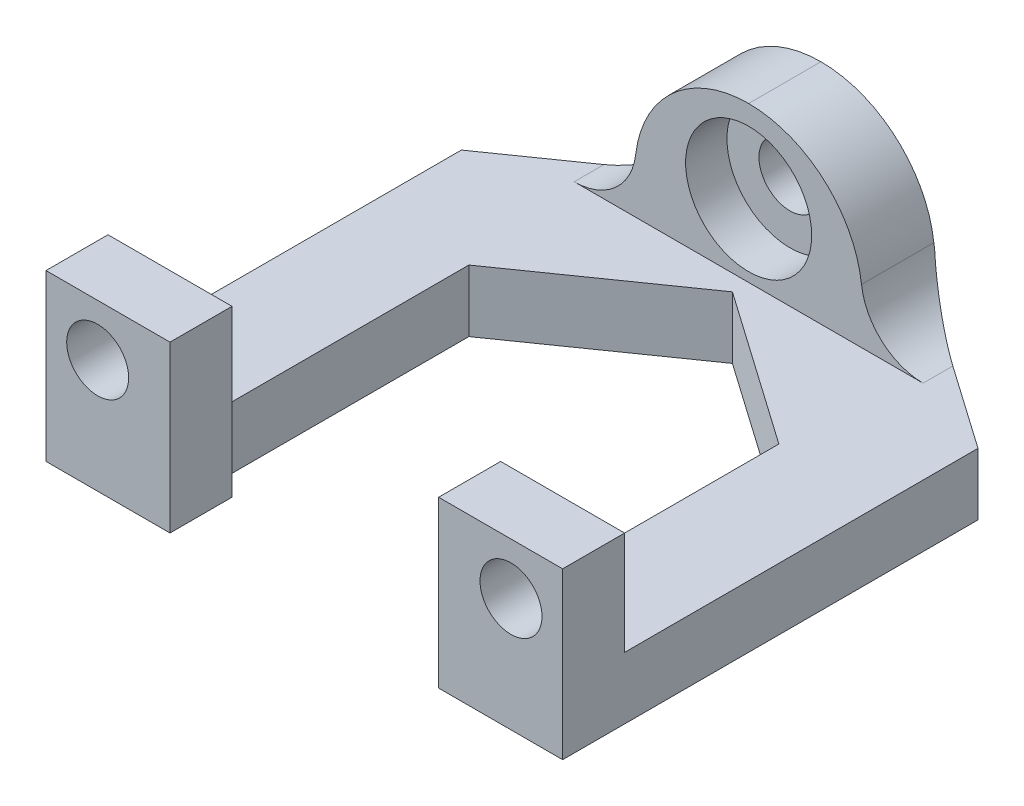
from build123d import *

# Parameters (mm, degrees)
BOSS_EXTRUDE1_DEPTH = 3
SKETCH2_W           = 5
SKETCH2_H           = 5
BOSS_EXTRUDE2_DEPTH = 3
SKETCH3_W           = 5
SKETCH3_H           = 5
BOSS_EXTRUDE4_DEPTH = 3
SKETCH4_R           = 1.5
CUT_EXTRUDE1_DEPTH  = 27.537709019
CHAMFER1_SIZE       = 7
CHAMFER1_SIZE2      = 4.901452767
CHAMFER2_SIZE       = 7
CHAMFER2_SIZE2      = 4.901452767
SKETCH6_W           = 11
SKETCH6_H           = 3.5
BOSS_EXTRUDE5_DEPTH = 4.5
SKETCH9_W           = 11
SKETCH9_H           = 3.5
BOSS_EXTRUDE6_DEPTH = 3
FILLET1_R           = 5.5
FILLET2_R           = 3
SKETCH16_R          = 1.5
CUT_EXTRUDE7_DEPTH  = 30.857997254
SKETCH17_R          = 3.05
CUT_EXTRUDE8_DEPTH  = 2
SKETCH18_W          = 3
SKETCH18_H          = 8
BOSS_EXTRUDE7_DEPTH = 1
SKETCH19_W          = 3
SKETCH19_H          = 8
BOSS_EXTRUDE8_DEPTH = 1


# Some blends are built 0.0001 mm under size
with BuildPart() as part:
    # Sketch1 → Boss-Extrude1 (new body)
    with BuildSketch(Plane(origin=(0, 0, 0), x_dir=(1, 0, 0), z_dir=(0, 1, 0))):
        Polygon((-7.5, -12.5), (-7.5, 2.962729178), (0, 8.214285714), (7.5, 2.962729178), (7.5, -12.5), (12.5, -12.5), (12.5, 12.5), (-12.5, 12.5), (-12.5, -12.5), align=None)
    extrude(amount=BOSS_EXTRUDE1_DEPTH)

    # Sketch2 → Boss-Extrude2 (add)
    with BuildSketch(Plane.XY.offset(12.5)):
        with Locations((-10, 5.5)):
            Rectangle(SKETCH2_W, SKETCH2_H)
    extrude(amount=-BOSS_EXTRUDE2_DEPTH)

    # Sketch3 → Boss-Extrude4 (add)
    with BuildSketch(Plane.XY.offset(12.5)):
        with Locations((10, 5.5)):
            Rectangle(SKETCH3_W, SKETCH3_H)
    extrude(amount=-BOSS_EXTRUDE4_DEPTH)

    # Sketch4 → Cut-Extrude1 (cut, through all)
    with BuildSketch(Plane(origin=(0, 0, 9.5), x_dir=(-1, 0, 0), z_dir=(0, 0, -1))):
        with Locations((10, 5.5)):
            Circle(SKETCH4_R)
        with Locations(Location((-10, 5.5, 0), (0, 0, 180))):
            Circle(SKETCH4_R)
    extrude(amount=-CUT_EXTRUDE1_DEPTH, mode=Mode.SUBTRACT)

    # Chamfer1
    chamfer1_edges = [part.edges().sort_by_distance(p)[0] for p in [
        (-12.5, 1.5, -12.5),
    ]]
    chamfer1_side = [part.faces().sort_by_distance(p)[0] for p in [
        (0, 1.5, -12.5),
    ]]
    chamfer(chamfer1_edges, length=CHAMFER1_SIZE, length2=CHAMFER1_SIZE2, reference=chamfer1_side[0])

    # Chamfer2
    chamfer2_edges = [part.edges().sort_by_distance(p)[0] for p in [
        (12.5, 1.5, -12.5),
    ]]
    chamfer2_side = [part.faces().sort_by_distance(p)[0] for p in [
        (3.5, 1.5, -12.5),
    ]]
    chamfer(chamfer2_edges, length=CHAMFER2_SIZE, length2=CHAMFER2_SIZE2, reference=chamfer2_side[0])

    # Sketch6 → Boss-Extrude5 (add)
    with BuildSketch(Plane(origin=(0, 3, 0), x_dir=(1, 0, 0), z_dir=(0, 1, 0))):
        with Locations((0, 10.75)):
            Rectangle(SKETCH6_W, SKETCH6_H)
    extrude(amount=BOSS_EXTRUDE5_DEPTH)

    # Sketch9 → Boss-Extrude6 (add)
    with BuildSketch(Plane(origin=(0, 7.5, 0), x_dir=(1, 0, 0), z_dir=(0, 1, 0))):
        with Locations((0, 10.75)):
            Rectangle(SKETCH9_W, SKETCH9_H)
    extrude(amount=BOSS_EXTRUDE6_DEPTH)

    # Fillet1
    fillet1_edges = [part.edges().sort_by_distance(p)[0] for p in [
        (5.5, 10.5, -10.75),
        (-5.5, 10.5, -10.75),
    ]]
    fillet(fillet1_edges, radius=FILLET1_R - 0.0001)  # a hair under: the kernel refuses the full size

    # Fillet2
    # the kernel refuses this fillet: 3 mm, written as the material it adds along each edge
    with BuildSketch(Plane(origin=(-5.5, 3, -9), x_dir=(-1, 0, 0), z_dir=(0, 0, -1))) as fillet2_piece_1_section:
        with BuildLine():
            CenterArc((2.940982655, 3), FILLET2_R, 186.755728099, 83.244271901)
            Line((-0.038187449, 2.647089966), (-0.336104459, 2.611798962))
            ThreePointArc((-0.336104459, 2.611798962), (-0.3, 2.0001), (-0.3, 0))
            Line((-0.3, 0), (0, -0.3))
            Line((0, -0.3), (2.940982655, -0.3))
            Line((2.940982655, -0.3), (2.940982655, 0))
        make_face()
    fillet2_piece_1 = extrude(amount=3.5, mode=Mode.PRIVATE)
    fillet2_piece_1 = split(fillet2_piece_1, bisect_by=Plane(origin=(-8.304245999, 3.032166693, -10.536445813), z_dir=(0.5735764363510474, 0, 0.8191520442889909)), keep=Keep.TOP, mode=Mode.PRIVATE)
    add(fillet2_piece_1)
    with BuildSketch(Plane(origin=(5.5, 3, -12.5), x_dir=(-0.014424698824614252, 0.9998959586196051, 0), z_dir=(0, 0, 1))) as fillet2_piece_2_section:
        with BuildLine():
            CenterArc((2.957265087, -2.983950768), FILLET2_R, 95.929225072, 83.244271901)
            Line((-0.042422789, -2.940676671), (-0.342391577, -2.936349262))
            Line((-0.342391577, -2.936349262), (-0.299968788, 0.00432741))
            Line((-0.299968788, 0.00432741), (0.00432741, 0.299968788))
            ThreePointArc((0.00432741, 0.299968788), (2.004219316, 0.271117947), (2.616375433, 0.298395077))
            Line((2.616375433, 0.298395077), (2.647365401, 0))
        make_face()
    fillet2_piece_2 = extrude(amount=3.5, mode=Mode.PRIVATE)
    fillet2_piece_2 = split(fillet2_piece_2, bisect_by=Plane(origin=(6.733396297, 4.098580715, -11.636366615), z_dir=(-0.5735764363510474, 0, 0.8191520442889909)), keep=Keep.TOP, mode=Mode.PRIVATE)
    add(fillet2_piece_2)

    # Sketch16 → Cut-Extrude7 (cut, through all)
    with BuildSketch(Plane(origin=(0, 0, -12.5), x_dir=(-1, 0, 0), z_dir=(0, 0, -1))):
        with Locations((0, 6.5)):
            Circle(SKETCH16_R)
    extrude(amount=-CUT_EXTRUDE7_DEPTH, mode=Mode.SUBTRACT)

    # Sketch17 → Cut-Extrude8 (cut)
    with BuildSketch(Plane.XY.offset(-9)):
        with Locations((0, 6.5)):
            Circle(SKETCH17_R)
    extrude(amount=-CUT_EXTRUDE8_DEPTH, mode=Mode.SUBTRACT)

    # Sketch18 → Boss-Extrude7 (add)
    with BuildSketch(Plane.ZY.offset(-7.5)):
        with Locations((11, 4)):
            Rectangle(SKETCH18_W, SKETCH18_H)
    extrude(amount=BOSS_EXTRUDE7_DEPTH)

    # Sketch19 → Boss-Extrude8 (add)
    with BuildSketch(Plane(origin=(-7.5, 0, 0), x_dir=(0, 0, -1), z_dir=(1, 0, 0))):
        with Locations((-11, 4)):
            Rectangle(SKETCH19_W, SKETCH19_H)
    extrude(amount=BOSS_EXTRUDE8_DEPTH)


solid = part.part
